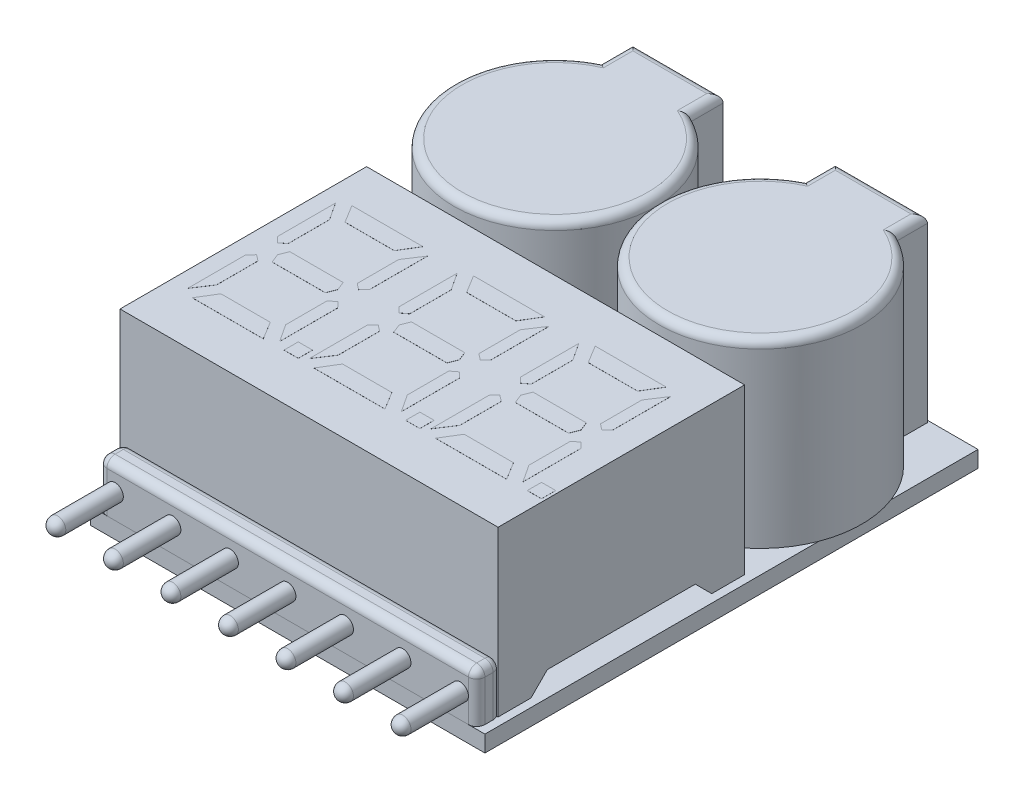
from build123d import *

# Parameters (mm, degrees)
IZIM1_W                         = 24
IZIM1_H                         = 40
Y_KSEKLIK_EKSTR_ZYON1_DEPTH     = 1
IZIM2_W                         = 23
IZIM2_H                         = 1.5
Y_KSEKLIK_EKSTR_ZYON2_DEPTH     = 3
IZIM3_R                         = 0.5
Y_KSEKLIK_EKSTR_ZYON3_DEPTH     = 4
IZIM4_W                         = 23
IZIM4_H                         = 15
Y_KSEKLIK_EKSTR_ZYON4_DEPTH     = 10
Y_KSEKLIK_EKSTR_ZYON10_DEPTH    = 11
KES_EKSTR_ZYON2_DEPTH           = 40
KES_EKSTR_ZYON3_DEPTH           = 20
RADYUS1_R                       = 0.5
RADYUS2_R                       = 0.5
Y_KSEKLIK_EKSTR_ZYON11_DEPTH    = 0.005
Y_KSEKLIK_EKSTR_ZYON11_2_DEPTH  = 0.005
Y_KSEKLIK_EKSTR_ZYON11_3_DEPTH  = 0.005
IZIM8_W                         = 0.864
IZIM8_H                         = 0.864
Y_KSEKLIK_EKSTR_ZYON11_4_DEPTH  = 0.005
Y_KSEKLIK_EKSTR_ZYON11_5_DEPTH  = 0.005
Y_KSEKLIK_EKSTR_ZYON11_6_DEPTH  = 0.005
Y_KSEKLIK_EKSTR_ZYON11_7_DEPTH  = 0.005
Y_KSEKLIK_EKSTR_ZYON11_8_DEPTH  = 0.005
Y_KSEKLIK_EKSTR_ZYON11_9_DEPTH  = 0.005
Y_KSEKLIK_EKSTR_ZYON11_10_DEPTH = 0.005
Y_KSEKLIK_EKSTR_ZYON11_11_DEPTH = 0.005
Y_KSEKLIK_EKSTR_ZYON11_12_DEPTH = 0.005
Y_KSEKLIK_EKSTR_ZYON11_13_DEPTH = 0.005
Y_KSEKLIK_EKSTR_ZYON11_14_DEPTH = 0.005
Y_KSEKLIK_EKSTR_ZYON11_15_DEPTH = 0.005
Y_KSEKLIK_EKSTR_ZYON11_16_DEPTH = 0.005
Y_KSEKLIK_EKSTR_ZYON11_17_DEPTH = 0.005
Y_KSEKLIK_EKSTR_ZYON11_18_DEPTH = 0.005
Y_KSEKLIK_EKSTR_ZYON11_19_DEPTH = 0.005
Y_KSEKLIK_EKSTR_ZYON11_20_DEPTH = 0.005
Y_KSEKLIK_EKSTR_ZYON11_21_DEPTH = 0.005
Y_KSEKLIK_EKSTR_ZYON11_22_DEPTH = 0.005
Y_KSEKLIK_EKSTR_ZYON11_23_DEPTH = 0.005
Y_KSEKLIK_EKSTR_ZYON11_24_DEPTH = 0.005
RADYUS3_R                       = 0.5
SKETCH1_W                       = 24
SKETCH1_H                       = 10
CUT_EXTRUDE1_DEPTH              = 10


with BuildPart() as part:
    # Çizim1 → Yükseklik-Ekstrüzyon1 (new body)
    with BuildSketch(Plane(origin=(0, 0, 0), x_dir=(1, 0, 0), z_dir=(0, 1, 0))):
        Rectangle(IZIM1_W, IZIM1_H)
    extrude(amount=Y_KSEKLIK_EKSTR_ZYON1_DEPTH)

    # Çizim4 → Yükseklik-Ekstrüzyon4 (add)
    with BuildSketch(Plane(origin=(0, 1, 0), x_dir=(1, 0, 0), z_dir=(0, 1, 0))):
        with Locations((0, -1.2)):
            Rectangle(IZIM4_W, IZIM4_H)
    extrude(amount=Y_KSEKLIK_EKSTR_ZYON4_DEPTH)

    # Çizim5 → Yükseklik-Ekstrüzyon10 (add)
    with BuildSketch(Plane(origin=(0, 1, 0), x_dir=(1, 0, 0), z_dir=(0, 1, 0))):
        with BuildLine():
            Line((3.448250256, 17.999900589), (3.448250256, 19.869891191))
            Line((3.448250256, 19.869891191), (9.051749744, 19.869891191))
            Line((9.051749744, 19.869891191), (9.051749744, 17.999900589))
            ThreePointArc((9.051749744, 17.999900589), (6.25, 6.360717151), (3.448250256, 17.999900589))
        make_face()
        with BuildLine():
            Line((-9, 18.026040556), (-9, 20))
            Line((-9, 20), (-3.5, 20))
            Line((-3.5, 20), (-3.5, 18.026040556))
            ThreePointArc((-3.5, 18.026040556), (-6.25, 6.360717151), (-9, 18.026040556))
        make_face()
    extrude(amount=Y_KSEKLIK_EKSTR_ZYON10_DEPTH)

    # Çizim6 → Kes-Ekstrüzyon2 (cut)
    with BuildSketch(Plane.ZY.offset(11.5)):
        Polygon((6.7, 1), (5.7, 2), (-3.3, 2), (-4.3, 1), align=None)
    extrude(amount=-KES_EKSTR_ZYON2_DEPTH, mode=Mode.SUBTRACT)

    # Çizim7 → Kes-Ekstrüzyon3 (cut)
    with BuildSketch(Plane.XY.offset(8.7)):
        Polygon((-9.5, 1), (-8.385993234, 2), (8.385993234, 2), (9.283653849, 1), align=None)
    extrude(amount=-KES_EKSTR_ZYON3_DEPTH, mode=Mode.SUBTRACT)

    # Radyus2
    radyus2_edges = [part.edges().sort_by_distance(p)[0] for p in [
        (6.25, 12, -6.360717151),
        (9.051749744, 12, -18.93489589),
        (6.25, 12, -19.869891191),
        (3.448250256, 12, -18.93489589),
        (-6.25, 12, -6.360717151),
        (-3.5, 12, -19.013020278),
        (-6.25, 12, -20),
        (-9, 12, -19.013020278),
    ]]
    fillet(radyus2_edges, radius=RADYUS2_R)

    # Sketch1 → Cut-Extrude1 (cut)
    with BuildSketch(Plane(origin=(0, 1, 0), x_dir=(1, 0, 0), z_dir=(0, 1, 0))):
        with Locations((0, -15)):
            Rectangle(SKETCH1_W, SKETCH1_H)
    extrude(amount=-CUT_EXTRUDE1_DEPTH, mode=Mode.SUBTRACT)


with BuildPart() as body_2:
    # Çizim2 → Yükseklik-Ekstrüzyon2 (new body)
    with BuildSketch(Plane(origin=(0, 1, 0), x_dir=(1, 0, 0), z_dir=(0, 1, 0))):
        with Locations((0, -9.25)):
            Rectangle(IZIM2_W, IZIM2_H)
    extrude(amount=Y_KSEKLIK_EKSTR_ZYON2_DEPTH)

    # Çizim3 → Yükseklik-Ekstrüzyon3 (add)
    with BuildSketch(Plane.XY.offset(10)):
        with Locations(Location((0, 2.5, 0), (0, 0, 180))):
            Circle(IZIM3_R)
        with Locations(Location((3.5, 2.5, 0), (0, 0, 180))):
            Circle(IZIM3_R)
        with Locations(Location((7, 2.5, 0), (0, 0, 180))):
            Circle(IZIM3_R)
        with Locations(Location((10.5, 2.5, 0), (0, 0, 180))):
            Circle(IZIM3_R)
        with Locations(Location((-3.5, 2.5, 0), (0, 0, 180))):
            Circle(IZIM3_R)
        with Locations(Location((-7, 2.5, 0), (0, 0, 180))):
            Circle(IZIM3_R)
        with Locations(Location((-10.5, 2.5, 0), (0, 0, 180))):
            Circle(IZIM3_R)
    extrude(amount=Y_KSEKLIK_EKSTR_ZYON3_DEPTH)

    # Radyus1
    radyus1_edges = [body_2.edges().sort_by_distance(p)[0] for p in [
        (11.5, 4, 9.25),
        (0, 4, 8.5),
        (-11.5, 4, 9.25),
        (0, 4, 10),
        (-11.5, 2.5, 8.5),
        (11.5, 2.5, 8.5),
        (11.5, 2.5, 10),
        (-11.5, 2.5, 10),
    ]]
    fillet(radyus1_edges, radius=RADYUS1_R - 0.0001)  # a hair under: the kernel refuses the full size

    # Radyus3
    radyus3_edges = [body_2.edges().sort_by_distance(p)[0] for p in [
        (0.5, 2.5, 14),
        (4, 2.5, 14),
        (7.5, 2.5, 14),
        (11, 2.5, 14),
        (-3, 2.5, 14),
        (-6.5, 2.5, 14),
        (-10, 2.5, 14),
    ]]
    fillet(radyus3_edges, radius=RADYUS3_R)


with BuildPart() as body_3:
    # Çizim8 → Yükseklik-Ekstrüzyon11 (new body)
    with BuildSketch(Plane(origin=(0, 11, 0), x_dir=(1, 0, 0), z_dir=(0, 1, 0))):
        Polygon((-9.346181896, -0.521080125), (-6.106181896, -0.521080125), (-5.892224965, -1.061080125), (-6.106181896, -1.601080125), (-9.346181896, -1.601080125), (-9.560138828, -1.061080125), align=None)
    extrude(amount=Y_KSEKLIK_EKSTR_ZYON11_DEPTH)


with BuildPart() as body_4:
    # Çizim8 → Y_kseklik-Ekstr_zyon11 2 (new body)
    with BuildSketch(Plane(origin=(0, 11, 0), x_dir=(1, 0, 0), z_dir=(0, 1, 0))):
        Polygon((-6.226486825, -4.835921097), (-9.225876967, -4.835921097), (-9.886181896, -5.915921097), (-5.566181896, -5.915921097), align=None)
    extrude(amount=Y_KSEKLIK_EKSTR_ZYON11_2_DEPTH)


with BuildPart() as body_5:
    # Çizim8 → Y_kseklik-Ekstr_zyon11 3 (new body)
    with BuildSketch(Plane(origin=(0, 11, 0), x_dir=(1, 0, 0), z_dir=(0, 1, 0))):
        Polygon((-9.828253737, -4.498001621), (-10.523221626, -5.556029141), (-10.523221626, -2.025897662), (-10.198004754, -1.693042413), (-9.828253737, -1.97709957), align=None)
    extrude(amount=Y_KSEKLIK_EKSTR_ZYON11_3_DEPTH)


with BuildPart() as body_6:
    # Çizim8 → Y_kseklik-Ekstr_zyon11 4 (new body)
    with BuildSketch(Plane(origin=(0, 11, 0), x_dir=(1, 0, 0), z_dir=(0, 1, 0))):
        with Locations((-3.907278664, -5.449770496)):
            Rectangle(IZIM8_W, IZIM8_H)
    extrude(amount=Y_KSEKLIK_EKSTR_ZYON11_4_DEPTH)


with BuildPart() as body_7:
    # Çizim8 → Y_kseklik-Ekstr_zyon11 5 (new body)
    with BuildSketch(Plane(origin=(0, 11, 0), x_dir=(1, 0, 0), z_dir=(0, 1, 0))):
        Polygon((-5.254359038, -1.693042413), (-5.624110055, -1.97709957), (-5.624110055, -4.498001621), (-4.929142166, -5.556029141), (-4.929142166, -2.025897662), align=None)
    extrude(amount=Y_KSEKLIK_EKSTR_ZYON11_5_DEPTH)


with BuildPart() as body_8:
    # Çizim8 → Y_kseklik-Ekstr_zyon11 6 (new body)
    with BuildSketch(Plane(origin=(0, 11, 0), x_dir=(1, 0, 0), z_dir=(0, 1, 0))):
        Polygon((-2.486181896, -5.915921097), (1.833818104, -5.915921097), (1.173513175, -4.835921097), (-1.825876967, -4.835921097), align=None)
    extrude(amount=Y_KSEKLIK_EKSTR_ZYON11_6_DEPTH)


with BuildPart() as body_9:
    # Çizim8 → Y_kseklik-Ekstr_zyon11 7 (new body)
    with BuildSketch(Plane(origin=(0, 11, 0), x_dir=(1, 0, 0), z_dir=(0, 1, 0))):
        Polygon((-5.566181896, 3.793760847), (-9.886181896, 3.793760847), (-9.225876967, 2.713760847), (-6.226486825, 2.713760847), align=None)
    extrude(amount=Y_KSEKLIK_EKSTR_ZYON11_7_DEPTH)


with BuildPart() as body_10:
    # Çizim8 → Y_kseklik-Ekstr_zyon11 8 (new body)
    with BuildSketch(Plane(origin=(0, 11, 0), x_dir=(1, 0, 0), z_dir=(0, 1, 0))):
        Polygon((4.913818104, -5.915921097), (9.233818104, -5.915921097), (8.573513175, -4.835921097), (5.574123033, -4.835921097), align=None)
    extrude(amount=Y_KSEKLIK_EKSTR_ZYON11_8_DEPTH)


with BuildPart() as body_11:
    # Çizim8 → Y_kseklik-Ekstr_zyon11 9 (new body)
    with BuildSketch(Plane(origin=(0, 11, 0), x_dir=(1, 0, 0), z_dir=(0, 1, 0))):
        Polygon((-5.624110055, 2.375841371), (-4.929142166, 3.43386889), (-4.929142166, -0.096262588), (-5.254359038, -0.429117837), (-5.624110055, -0.14506068), align=None)
    extrude(amount=Y_KSEKLIK_EKSTR_ZYON11_9_DEPTH)


with BuildPart() as body_12:
    # Çizim8 → Y_kseklik-Ekstr_zyon11 10 (new body)
    with BuildSketch(Plane(origin=(0, 11, 0), x_dir=(1, 0, 0), z_dir=(0, 1, 0))):
        Polygon((5.453818104, -1.601080125), (8.693818104, -1.601080125), (8.907775035, -1.061080125), (8.693818104, -0.521080125), (5.453818104, -0.521080125), (5.239861172, -1.061080125), align=None)
    extrude(amount=Y_KSEKLIK_EKSTR_ZYON11_10_DEPTH)


with BuildPart() as body_13:
    # Çizim8 → Y_kseklik-Ekstr_zyon11 11 (new body)
    with BuildSketch(Plane(origin=(0, 11, 0), x_dir=(1, 0, 0), z_dir=(0, 1, 0))):
        Polygon((-10.198004754, -0.429117837), (-9.828253737, -0.14506068), (-9.828253737, 2.375841371), (-10.523221626, 3.43386889), (-10.523221626, -0.096262588), align=None)
    extrude(amount=Y_KSEKLIK_EKSTR_ZYON11_11_DEPTH)


with BuildPart() as body_14:
    # Çizim8 → Y_kseklik-Ekstr_zyon11 12 (new body)
    with BuildSketch(Plane(origin=(0, 11, 0), x_dir=(1, 0, 0), z_dir=(0, 1, 0))):
        Polygon((-2.428253737, -4.498001621), (-3.123221626, -5.556029141), (-3.123221626, -2.025897662), (-2.798004754, -1.693042413), (-2.428253737, -1.97709957), align=None)
    extrude(amount=Y_KSEKLIK_EKSTR_ZYON11_12_DEPTH)


with BuildPart() as body_15:
    # Çizim8 → Y_kseklik-Ekstr_zyon11 13 (new body)
    with BuildSketch(Plane(origin=(0, 11, 0), x_dir=(1, 0, 0), z_dir=(0, 1, 0))):
        Polygon((1.293818104, -1.601080125), (-1.946181896, -1.601080125), (-2.160138828, -1.061080125), (-1.946181896, -0.521080125), (1.293818104, -0.521080125), (1.507775035, -1.061080125), align=None)
    extrude(amount=Y_KSEKLIK_EKSTR_ZYON11_13_DEPTH)


with BuildPart() as body_16:
    # Çizim8 → Y_kseklik-Ekstr_zyon11 14 (new body)
    with BuildSketch(Plane(origin=(0, 11, 0), x_dir=(1, 0, 0), z_dir=(0, 1, 0))):
        with Locations((3.492721336, -5.449770496)):
            Rectangle(IZIM8_W, IZIM8_H)
    extrude(amount=Y_KSEKLIK_EKSTR_ZYON11_14_DEPTH)


with BuildPart() as body_17:
    # Çizim8 → Y_kseklik-Ekstr_zyon11 15 (new body)
    with BuildSketch(Plane(origin=(0, 11, 0), x_dir=(1, 0, 0), z_dir=(0, 1, 0))):
        Polygon((2.145640962, -1.693042413), (1.775889945, -1.97709957), (1.775889945, -4.498001621), (2.470857834, -5.556029141), (2.470857834, -2.025897662), align=None)
    extrude(amount=Y_KSEKLIK_EKSTR_ZYON11_15_DEPTH)


with BuildPart() as body_18:
    # Çizim8 → Y_kseklik-Ekstr_zyon11 16 (new body)
    with BuildSketch(Plane(origin=(0, 11, 0), x_dir=(1, 0, 0), z_dir=(0, 1, 0))):
        Polygon((1.833818104, 3.793760847), (-2.486181896, 3.793760847), (-1.825876967, 2.713760847), (1.173513175, 2.713760847), align=None)
    extrude(amount=Y_KSEKLIK_EKSTR_ZYON11_16_DEPTH)


with BuildPart() as body_19:
    # Çizim8 → Y_kseklik-Ekstr_zyon11 17 (new body)
    with BuildSketch(Plane(origin=(0, 11, 0), x_dir=(1, 0, 0), z_dir=(0, 1, 0))):
        Polygon((1.775889945, 2.375841371), (2.470857834, 3.43386889), (2.470857834, -0.096262588), (2.145640962, -0.429117837), (1.775889945, -0.14506068), align=None)
    extrude(amount=Y_KSEKLIK_EKSTR_ZYON11_17_DEPTH)


with BuildPart() as body_20:
    # Çizim8 → Y_kseklik-Ekstr_zyon11 18 (new body)
    with BuildSketch(Plane(origin=(0, 11, 0), x_dir=(1, 0, 0), z_dir=(0, 1, 0))):
        Polygon((-2.798004754, -0.429117837), (-2.428253737, -0.14506068), (-2.428253737, 2.375841371), (-3.123221626, 3.43386889), (-3.123221626, -0.096262588), align=None)
    extrude(amount=Y_KSEKLIK_EKSTR_ZYON11_18_DEPTH)


with BuildPart() as body_21:
    # Çizim8 → Y_kseklik-Ekstr_zyon11 19 (new body)
    with BuildSketch(Plane(origin=(0, 11, 0), x_dir=(1, 0, 0), z_dir=(0, 1, 0))):
        Polygon((4.971746263, -4.498001621), (4.276778374, -5.556029141), (4.276778374, -2.025897662), (4.601995246, -1.693042413), (4.971746263, -1.97709957), align=None)
    extrude(amount=Y_KSEKLIK_EKSTR_ZYON11_19_DEPTH)


with BuildPart() as body_22:
    # Çizim8 → Y_kseklik-Ekstr_zyon11 20 (new body)
    with BuildSketch(Plane(origin=(0, 11, 0), x_dir=(1, 0, 0), z_dir=(0, 1, 0))):
        with Locations((10.892721336, -5.449770496)):
            Rectangle(IZIM8_W, IZIM8_H)
    extrude(amount=Y_KSEKLIK_EKSTR_ZYON11_20_DEPTH)


with BuildPart() as body_23:
    # Çizim8 → Y_kseklik-Ekstr_zyon11 21 (new body)
    with BuildSketch(Plane(origin=(0, 11, 0), x_dir=(1, 0, 0), z_dir=(0, 1, 0))):
        Polygon((9.545640962, -1.693042413), (9.175889945, -1.97709957), (9.175889945, -4.498001621), (9.870857834, -5.556029141), (9.870857834, -2.025897662), align=None)
    extrude(amount=Y_KSEKLIK_EKSTR_ZYON11_21_DEPTH)


with BuildPart() as body_24:
    # Çizim8 → Y_kseklik-Ekstr_zyon11 22 (new body)
    with BuildSketch(Plane(origin=(0, 11, 0), x_dir=(1, 0, 0), z_dir=(0, 1, 0))):
        Polygon((9.233818104, 3.793760847), (4.913818104, 3.793760847), (5.574123033, 2.713760847), (8.573513175, 2.713760847), align=None)
    extrude(amount=Y_KSEKLIK_EKSTR_ZYON11_22_DEPTH)


with BuildPart() as body_25:
    # Çizim8 → Y_kseklik-Ekstr_zyon11 23 (new body)
    with BuildSketch(Plane(origin=(0, 11, 0), x_dir=(1, 0, 0), z_dir=(0, 1, 0))):
        Polygon((9.175889945, 2.375841371), (9.870857834, 3.43386889), (9.870857834, -0.096262588), (9.545640962, -0.429117837), (9.175889945, -0.14506068), align=None)
    extrude(amount=Y_KSEKLIK_EKSTR_ZYON11_23_DEPTH)


with BuildPart() as body_26:
    # Çizim8 → Y_kseklik-Ekstr_zyon11 24 (new body)
    with BuildSketch(Plane(origin=(0, 11, 0), x_dir=(1, 0, 0), z_dir=(0, 1, 0))):
        Polygon((4.601995246, -0.429117837), (4.971746263, -0.14506068), (4.971746263, 2.375841371), (4.276778374, 3.43386889), (4.276778374, -0.096262588), align=None)
    extrude(amount=Y_KSEKLIK_EKSTR_ZYON11_24_DEPTH)


solid = Compound([part.part, body_2.part, body_3.part, body_4.part, body_5.part, body_6.part, body_7.part, body_8.part, body_9.part, body_10.part, body_11.part, body_12.part, body_13.part, body_14.part, body_15.part, body_16.part, body_17.part, body_18.part, body_19.part, body_20.part, body_21.part, body_22.part, body_23.part, body_24.part, body_25.part, body_26.part])
